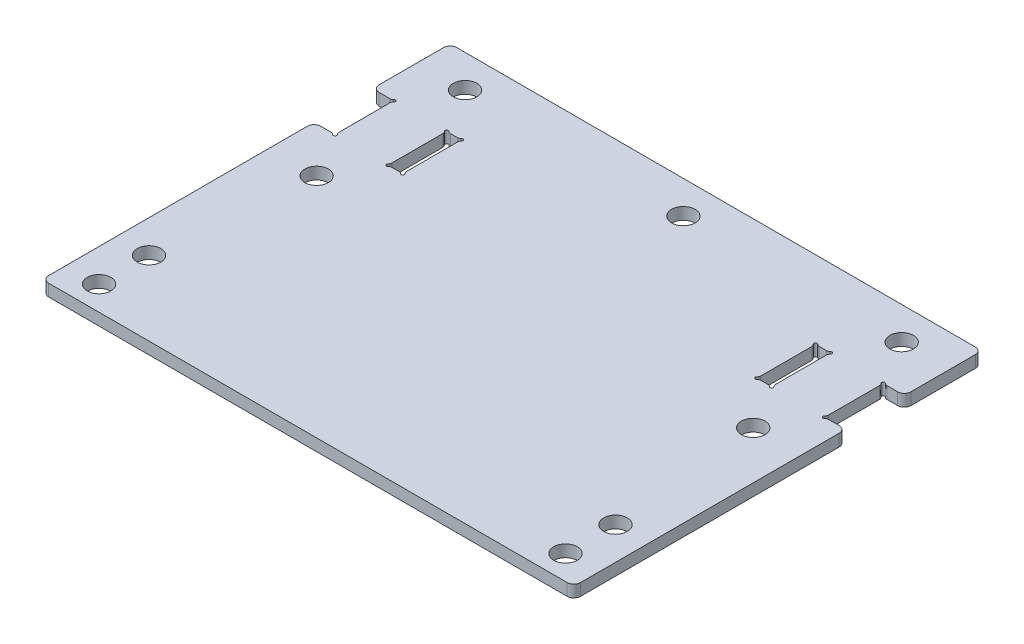
from build123d import *

# Parameters (mm, degrees)
STOCK_BEE_ZERKER_START                     = 4.064
STOCK_BEE_ZERKER_2_0_MULTIBODY_1_OUTLINE_R = 2.2479
STOCK_BEE_ZERKER_2_0_MULTIBODY_1_OUTLINE_W = 2.54
STOCK_BEE_ZERKER_2_0_MULTIBODY_1_OUTLINE_H = 10.89526775
STOCK_BEE_ZERKER_2_0_MULTIBODY_1_DEPTH     = 2.286
SKETCH1_W                                  = 2.794
SKETCH1_H                                  = 11.14926775
SKETCH1_W_2                                = 2.54
SKETCH1_H_2                                = 10.89526775
CUT_EXTRUDE1_DEPTH                         = 67.506087708
SKETCH2_R                                  = 0.3175
CUT_EXTRUDE2_DEPTH                         = 67.327231853
FILLET1_R                                  = 0.635
FILLET2_R                                  = 1.27


# Read off the part's stored shape, not the designer's step: Stock-Bee-zerker 2.0 Multibody-1
with BuildPart() as part:
    # Stock-Bee-zerker 2.0 Multibody-1 outline → Stock-Bee-zerker 2.0 Multibody-1 (new body)
    with BuildSketch(Plane(origin=(0, 0, 0), x_dir=(1, 0, 0), z_dir=(0, 1, 0)).offset(STOCK_BEE_ZERKER_START)):
        Polygon((-50.8, 16.917066125), (-50.8, -35.16122), (50.8, -35.16122), (50.8, 16.917066125), (46.7868, 16.917066125), (46.7868, 27.812333875), (50.8, 27.812333875), (50.8, 42.8625), (-50.8, 42.8625), (-50.8, 27.812333875), (-46.7868, 27.812333875), (-46.7868, 16.917066125), align=None)
        with Locations((-44.45, -30.39872)):
            Circle(STOCK_BEE_ZERKER_2_0_MULTIBODY_1_OUTLINE_R, mode=Mode.SUBTRACT)
        with Locations((-44.45, -20.87372)):
            Circle(STOCK_BEE_ZERKER_2_0_MULTIBODY_1_OUTLINE_R, mode=Mode.SUBTRACT)
        with Locations((44.45, -30.39872)):
            Circle(STOCK_BEE_ZERKER_2_0_MULTIBODY_1_OUTLINE_R, mode=Mode.SUBTRACT)
        with Locations((44.45, -20.87372)):
            Circle(STOCK_BEE_ZERKER_2_0_MULTIBODY_1_OUTLINE_R, mode=Mode.SUBTRACT)
        with Locations((-41.6052, 8.2169)):
            Circle(STOCK_BEE_ZERKER_2_0_MULTIBODY_1_OUTLINE_R, mode=Mode.SUBTRACT)
        with Locations((-35.1536, 22.3647)):
            Rectangle(STOCK_BEE_ZERKER_2_0_MULTIBODY_1_OUTLINE_W, STOCK_BEE_ZERKER_2_0_MULTIBODY_1_OUTLINE_H, mode=Mode.SUBTRACT)
        with Locations((-41.6052, 36.5125)):
            Circle(STOCK_BEE_ZERKER_2_0_MULTIBODY_1_OUTLINE_R, mode=Mode.SUBTRACT)
        with Locations((0, 36.5125)):
            Circle(STOCK_BEE_ZERKER_2_0_MULTIBODY_1_OUTLINE_R, mode=Mode.SUBTRACT)
        with Locations((41.6052, 8.2169)):
            Circle(STOCK_BEE_ZERKER_2_0_MULTIBODY_1_OUTLINE_R, mode=Mode.SUBTRACT)
        with Locations((35.1536, 22.3647)):
            Rectangle(STOCK_BEE_ZERKER_2_0_MULTIBODY_1_OUTLINE_W, STOCK_BEE_ZERKER_2_0_MULTIBODY_1_OUTLINE_H, mode=Mode.SUBTRACT)
        with Locations((41.6052, 36.5125)):
            Circle(STOCK_BEE_ZERKER_2_0_MULTIBODY_1_OUTLINE_R, mode=Mode.SUBTRACT)
    extrude(amount=STOCK_BEE_ZERKER_2_0_MULTIBODY_1_DEPTH)

    # Sketch1 → Cut-Extrude1 (cut, through all)
    # profile 1 of 3: a face of its own
    with BuildSketch(Plane(origin=(0, 6.35, 0), x_dir=(1, 0, 0), z_dir=(0, 1, 0))):
        Polygon((-46.7868, 16.917066125), (-50.8, 16.917066125), (-50.8, -35.16122), (50.8, -35.16122), (50.8, 16.917066125), (46.7868, 16.917066125), (46.7868, 27.812333875), (50.8, 27.812333875), (50.8, 42.8625), (-50.8, 42.8625), (-50.8, 27.812333875), (-46.7868, 27.812333875), align=None)
        Polygon((-46.6598, 16.790066125), (-50.673, 16.790066125), (-50.673, -35.03422), (50.673, -35.03422), (50.673, 16.790066125), (46.6598, 16.790066125), (46.6598, 27.939333875), (50.673, 27.939333875), (50.673, 42.7355), (-50.673, 42.7355), (-50.673, 27.939333875), (-46.6598, 27.939333875), align=None, mode=Mode.SUBTRACT)
    # profile 2 of 3: a face of its own
    with BuildSketch(Plane(origin=(0, 6.35, 0), x_dir=(1, 0, 0), z_dir=(0, 1, 0))):
        with Locations((-35.1536, 22.3647)):
            Rectangle(SKETCH1_W, SKETCH1_H)
        with Locations((-35.1536, 22.3647)):
            Rectangle(SKETCH1_W_2, SKETCH1_H_2, mode=Mode.SUBTRACT)
    # profile 3 of 3: a face of its own
    with BuildSketch(Plane(origin=(0, 6.35, 0), x_dir=(1, 0, 0), z_dir=(0, 1, 0))):
        with Locations((35.1536, 22.3647)):
            Rectangle(SKETCH1_W, SKETCH1_H)
        with Locations((35.1536, 22.3647)):
            Rectangle(SKETCH1_W_2, SKETCH1_H_2, mode=Mode.SUBTRACT)
    extrude(amount=-CUT_EXTRUDE1_DEPTH, mode=Mode.SUBTRACT)

    # Sketch2 → Cut-Extrude2 (cut, through all)
    with BuildSketch(Plane(origin=(0, 6.35, 0), x_dir=(1, 0, 0), z_dir=(0, 1, 0))):
        with Locations((-46.6598, 27.939333875)):
            Circle(SKETCH2_R)
        with Locations((-46.6598, 16.790066125)):
            Circle(SKETCH2_R)
        with Locations((-36.5506, 16.790066125)):
            Circle(SKETCH2_R)
        with Locations((-33.7566, 16.790066125)):
            Circle(SKETCH2_R)
        with Locations((-33.7566, 27.939333875)):
            Circle(SKETCH2_R)
        with Locations((-36.5506, 27.939333875)):
            Circle(SKETCH2_R)
        with Locations((33.7566, 27.939333875)):
            Circle(SKETCH2_R)
        with Locations((36.5506, 27.939333875)):
            Circle(SKETCH2_R)
        with Locations((33.7566, 16.790066125)):
            Circle(SKETCH2_R)
        with Locations((36.5506, 16.790066125)):
            Circle(SKETCH2_R)
        with Locations((46.6598, 16.790066125)):
            Circle(SKETCH2_R)
        with Locations((46.6598, 27.939333875)):
            Circle(SKETCH2_R)
    extrude(amount=-CUT_EXTRUDE2_DEPTH, mode=Mode.SUBTRACT)

    # Fillet1
    fillet1_edges = [part.edges().sort_by_distance(p)[0] for p in [
        (33.7566, 5.207, -17.107566125),
        (33.7566, 5.207, -27.621833875),
        (36.2331, 5.207, -16.790066125),
        (36.5506, 5.207, -27.621833875),
        (-36.5506, 5.207, -17.107566125),
        (-36.5506, 5.207, -27.621833875),
        (-34.0741, 5.207, -16.790066125),
        (-33.7566, 5.207, -27.621833875),
        (-46.6598, 5.207, -27.621833875),
        (-46.6598, 5.207, -17.107566125),
        (46.9773, 5.207, -27.939333875),
        (46.6598, 5.207, -17.107566125),
        (-36.2331, 5.207, -27.939333875),
        (34.0741, 5.207, -27.939333875),
        (36.2331, 5.207, -27.939333875),
        (34.0741, 5.207, -16.790066125),
        (-34.0741, 5.207, -27.939333875),
        (-33.7566, 5.207, -17.107566125),
        (-36.2331, 5.207, -16.790066125),
        (-46.9773, 5.207, -16.790066125),
        (36.5506, 5.207, -17.107566125),
        (46.9773, 5.207, -16.790066125),
        (46.6598, 5.207, -27.621833875),
        (-46.9773, 5.207, -27.939333875),
    ]]
    fillet(fillet1_edges, radius=FILLET1_R)

    # Fillet2
    fillet2_edges = [part.edges().sort_by_distance(p)[0] for p in [
        (-50.673, 5.207, -16.790066125),
        (-50.673, 5.207, 35.03422),
        (50.673, 5.207, 35.03422),
        (50.673, 5.207, -16.790066125),
        (50.673, 5.207, -27.939333875),
        (50.673, 5.207, -42.7355),
        (-50.673, 5.207, -42.7355),
        (-50.673, 5.207, -27.939333875),
    ]]
    fillet(fillet2_edges, radius=FILLET2_R)


solid = part.part
